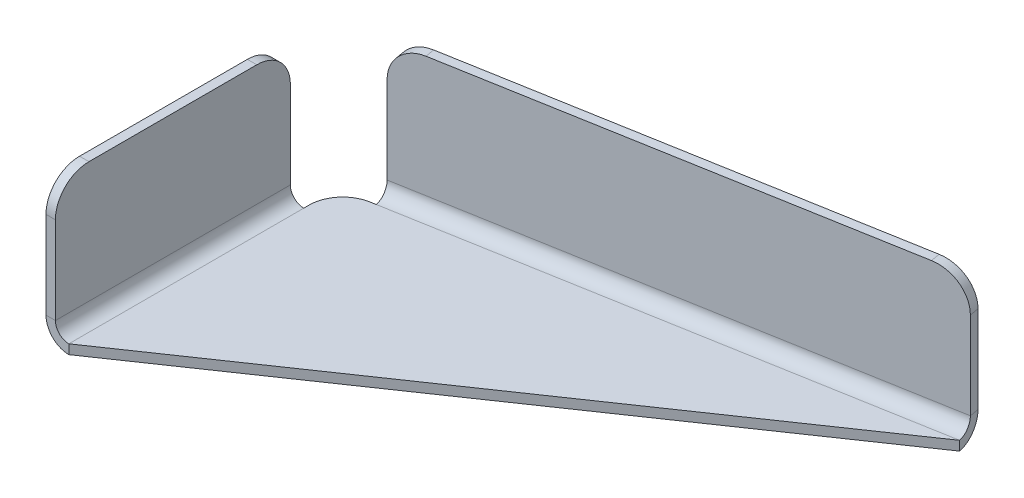
from build123d import *

# Parameters (mm, degrees)
BASE_FLANGE1_DEPTH      = 0.7
EDGE_FLANGE1_DEPTH      = 17.5
EDGE_FLANGE1_BEND_DEPTH = 37.5
BREAK_CORNER1_START     = -1.7
BREAK_CORNER1_DEPTH     = 0.7
BREAK_CORNER1_2_DEPTH   = 0.7
BREAK_CORNER1_START_2   = -0.7
BREAK_CORNER1_3_DEPTH   = 0.7


# Read off the part's stored shape, not the designer's step: Break-Corner1
# Sheet-metal steps are written as plain solids
with BuildPart() as part:
    # Sketch1 → Base-Flange1 (new body)
    with BuildSketch(Plane(origin=(0, 0, 0), x_dir=(1, 0, 0), z_dir=(0, 1, 0))):
        Polygon((0, 0), (0, -20), (39.39231012, 6.945927107), align=None)
    extrude(amount=-BASE_FLANGE1_DEPTH)

    # Edge-Flange1 section (across the edge) → Edge-Flange1 (add)
    with BuildSketch(Plane(origin=(-1, 0, 2.5), x_dir=(1, 0, 0), z_dir=(0, 0, 1))):
        with BuildLine():
            Line((-0.7, 1), (-0.7, 10))
            Line((-0.7, 10), (0, 10))
            Line((0, 10), (0, 1))
            ThreePointArc((0, 1), (0.292893219, 0.292893219), (1, 0))
            Line((1, 0), (1, -0.7))
            ThreePointArc((1, -0.7), (-0.202081528, -0.202081528), (-0.7, 1))
        make_face()
    extrude(amount=EDGE_FLANGE1_DEPTH)

    # Edge-Flange1 section 2 (across the edge) → Edge-Flange1 bend (add)
    with BuildSketch(Plane(origin=(39.218661943, 0, -7.93073486), x_dir=(0.1736481776669273, 3.4914813388431334e-15, 0.9848077530122086), z_dir=(-0.9848077530122086, 0, 0.1736481776669273))):
        with BuildLine():
            Line((-0.7, 1), (-0.7, 10))
            Line((-0.7, 10), (0, 10))
            Line((0, 10), (0, 1))
            ThreePointArc((0, 1), (0.292893219, 0.292893219), (1, 0))
            Line((1, 0), (1, -0.7))
            ThreePointArc((1, -0.7), (-0.202081528, -0.202081528), (-0.7, 1))
        make_face()
    extrude(amount=EDGE_FLANGE1_BEND_DEPTH)

    # Break-Corner1 outline → Break-Corner1 (cut)
    with BuildSketch(Plane(origin=(0, 0, 0), x_dir=(0.9848077530122086, 0, -0.173648177666927), z_dir=(0.17364817766692697, 0, 0.9848077530122088)).offset(BREAK_CORNER1_START)):
        with BuildLine():
            ThreePointArc((2.5, 7.5), (3.232233047, 9.267766953), (5, 10))
            Line((5, 10), (2.5, 10))
            Line((2.5, 10), (2.5, 7.5))
        make_face()
        with BuildLine():
            ThreePointArc((37.5, 10), (39.267766953, 9.267766953), (40, 7.5))
            Line((40, 7.5), (40, 10))
            Line((40, 10), (37.5, 10))
        make_face()
    extrude(amount=BREAK_CORNER1_DEPTH, mode=Mode.SUBTRACT)

    # Break-Corner1 2 outline → Break-Corner1 2 (cut)
    with BuildSketch(Plane.YZ.offset(BREAK_CORNER1_START)):
        with BuildLine():
            ThreePointArc((7.5, 20), (9.267766953, 19.267766953), (10, 17.5))
            Line((10, 17.5), (10, 20))
            Line((10, 20), (7.5, 20))
        make_face()
        with BuildLine():
            ThreePointArc((10, 5), (9.267766953, 3.232233047), (7.5, 2.5))
            Line((7.5, 2.5), (10, 2.5))
            Line((10, 2.5), (10, 5))
        make_face()
    extrude(amount=BREAK_CORNER1_2_DEPTH, mode=Mode.SUBTRACT)

    # Break-Corner1 3 outline → Break-Corner1 3 (cut)
    with BuildSketch(Plane(origin=(0, 0, 0), x_dir=(1, 0, 0), z_dir=(0, 1, 0)).offset(BREAK_CORNER1_START_2)):
        with BuildLine():
            ThreePointArc((0, -2.097749078), (0.584888892, -0.490780054), (2.065879556, 0.364270305))
            Line((2.065879556, 0.364270305), (0, 0))
            Line((0, 0), (0, -2.097749078))
        make_face()
    extrude(amount=BREAK_CORNER1_3_DEPTH, mode=Mode.SUBTRACT)


solid = part.part
